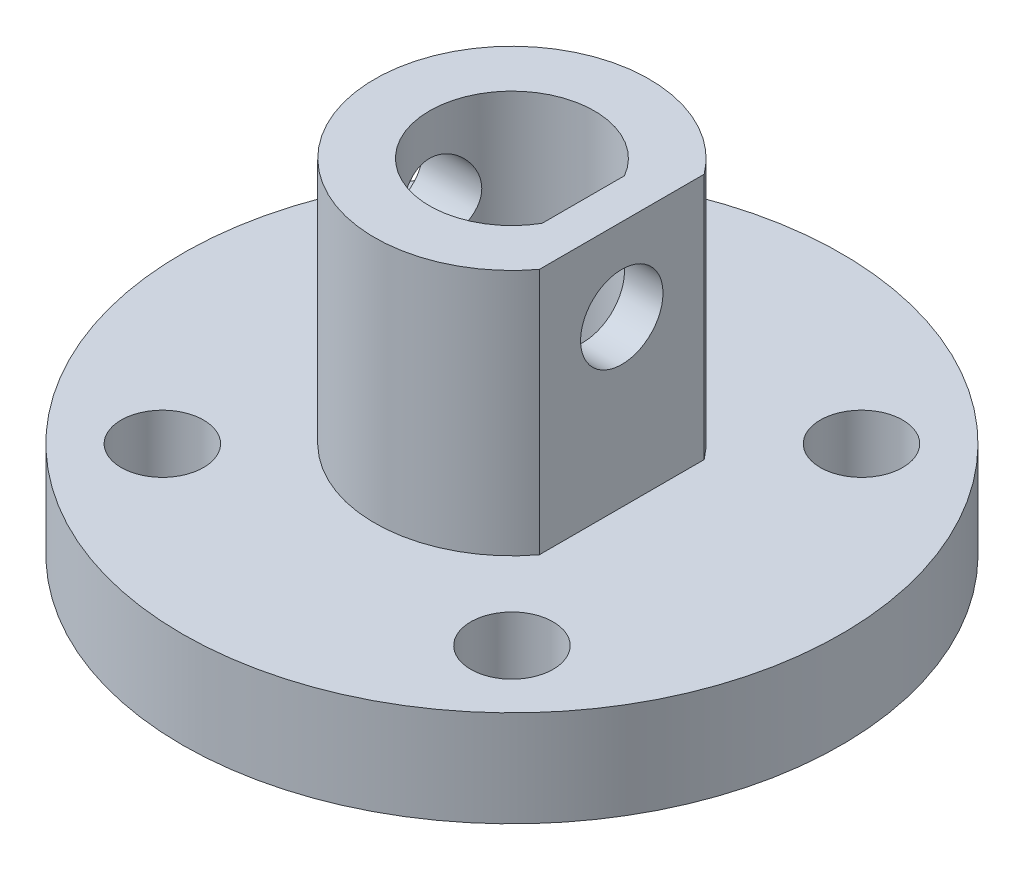
from build123d import *

# Parameters (mm, degrees)
SKETCH1_R           = 12
SKETCH1_R_2         = 1.5
BOSS_EXTRUDE1_DEPTH = 3.5
BOSS_EXTRUDE2_DEPTH = 9
SKETCH3_R           = 1.5
CUT_EXTRUDE1_DEPTH  = 19


with BuildPart() as part:
    # Sketch1 → Boss-Extrude1 (new body)
    with BuildSketch(Plane(origin=(0, 0, 0), x_dir=(1, 0, 0), z_dir=(0, 1, 0))):
        Circle(SKETCH1_R)
        with BuildLine():
            Line((2.598076211, 1.5), (2.598076211, -1.5))
            ThreePointArc((2.598076211, -1.5), (-2.974334584, -0.391578577), (2.121320344, 2.121320344))
            ThreePointArc((2.121320344, 2.121320344), (2.380060021, 1.826284287), (2.598076211, 1.5))
        make_face(mode=Mode.SUBTRACT)
        with Locations((-6.363961031, -6.363961031)):
            Circle(SKETCH1_R_2, mode=Mode.SUBTRACT)
        with Locations((6.363961031, -6.363961031)):
            Circle(SKETCH1_R_2, mode=Mode.SUBTRACT)
        with Locations((-6.363961031, 6.363961031)):
            Circle(SKETCH1_R_2, mode=Mode.SUBTRACT)
        with Locations((6.363961031, 6.363961031)):
            Circle(SKETCH1_R_2, mode=Mode.SUBTRACT)
    extrude(amount=BOSS_EXTRUDE1_DEPTH)

    # Sketch2 → Boss-Extrude2 (add)
    with BuildSketch(Plane(origin=(0, 3.5, 0), x_dir=(1, 0, 0), z_dir=(0, 1, 0))):
        with BuildLine():
            Line((4, -3), (4, 3))
            ThreePointArc((4, 3), (-5, 0), (4, -3))
        make_face()
        with BuildLine():
            Line((2.598076211, 1.5), (2.598076211, -1.5))
            ThreePointArc((2.598076211, -1.5), (-3, 0), (2.598076211, 1.5))
        make_face(mode=Mode.SUBTRACT)
    extrude(amount=BOSS_EXTRUDE2_DEPTH)

    # Sketch3 → Cut-Extrude1 (cut)
    with BuildSketch(Plane(origin=(4, 0, 0), x_dir=(0, 0, -1), z_dir=(1, 0, 0))):
        with Locations((0, 9.5)):
            Circle(SKETCH3_R)
    extrude(amount=-CUT_EXTRUDE1_DEPTH, mode=Mode.SUBTRACT)


solid = part.part
